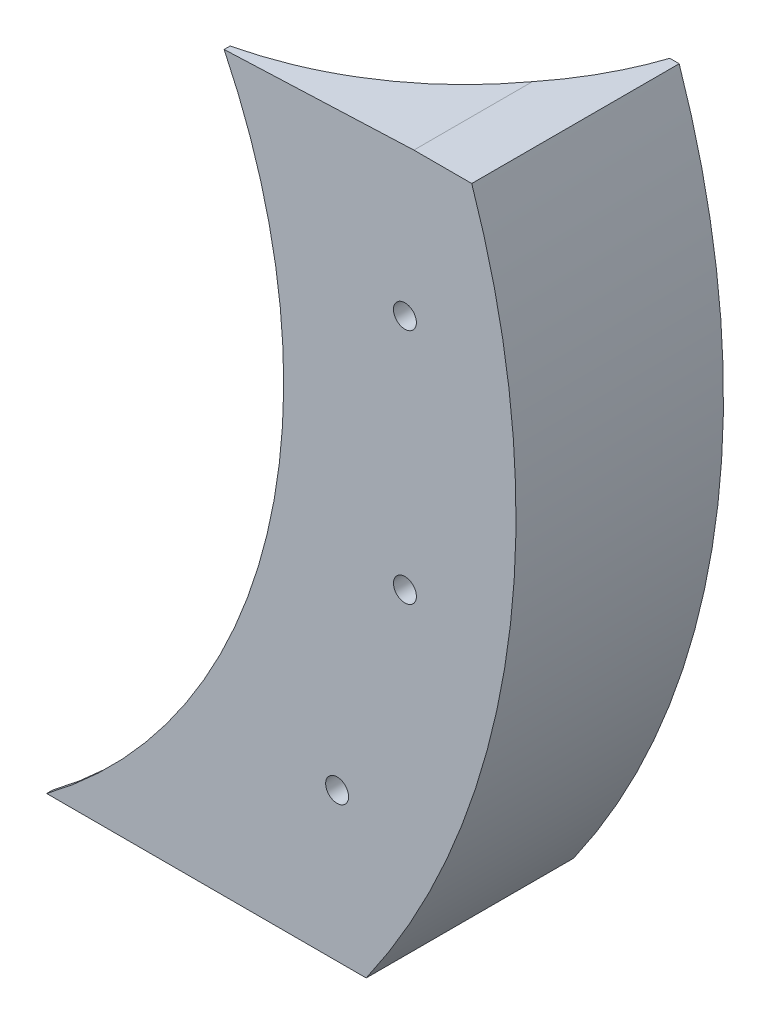
from build123d import *

# Parameters (mm, degrees)
BOSS_EXTRUDE1_DEPTH  = 44.45
CUT_SWEEP2_PROFILE_R = 63.5


# Read off the part's stored shape, not the designer's step: #10 (0.1935) Diameter Hole1
with BuildPart() as part:
    # Sketch1 → Boss-Extrude1 (new body)
    with BuildSketch(Plane.XY):
        with BuildLine():
            ThreePointArc((114.233948766, 55.494188428), (123.433861724, -29.884473893), (76.2, -101.6))
            Line((76.2, -101.6), (130.136274728, -101.6))
            ThreePointArc((130.136274728, -101.6), (163.128273679, -25.439660506), (154.893148654, 57.15))
            Line((154.893148654, 57.15), (114.233948766, 55.494188428))
        make_face()
        with BuildLine():
            ThreePointArc((154.893148654, 57.15), (163.128273679, -25.439660506), (130.136274728, -101.6))
            Line((130.136274728, -101.6), (144.672121212, -101.6))
            ThreePointArc((144.672121212, -101.6), (175.016349172, -24.937124506), (167.291542392, 57.15))
            Line((167.291542392, 57.15), (154.893148654, 57.15))
        make_face()
    extrude(amount=BOSS_EXTRUDE1_DEPTH)

    # Cut-Sweep2: sweep along a path in Sketch4
    with BuildLine(Plane(origin=(0, 0, -19.05), x_dir=(-1, 0, 0), z_dir=(0, 0, -1))) as cut_sweep2_path:
        ThreePointArc((-99.924396675, 55.494188428), (-109.396263278, -33.120198984), (-52.363441445, -101.6))
    # Cut-Sweep2 profile (on start of the path) → Cut-Sweep2 (sweep, cut)
    with BuildSketch(Plane(origin=(99.924396675, 55.494188428, -19.05), x_dir=(-0.874229192252917, -0.4855134595588597, 0), z_dir=(0.4855134595588597, -0.874229192252917, 0))):
        Circle(CUT_SWEEP2_PROFILE_R)
    sweep(path=cut_sweep2_path.line, mode=Mode.SUBTRACT)

    # #10 (0.1935) Diameter Hole1 outline → #10 (0.1935) Diameter Hole1 (revolve, cut)
    with BuildSketch(Plane(origin=(138.444039196, -69.85, 0), x_dir=(1, 0, 0), z_dir=(0, -1, 0))):
        Polygon((5.3975, 24.550727953), (5.3975, 29.635744444), (2.45745, 32.575794433), (2.45745, 44.45), (0, 44.45), (0, 24.550727953), align=None)
    revolve(axis=Axis((138.444039196, -69.85, 0), (0, 0, 1)), mode=Mode.SUBTRACT)

    # 10 _0.1935_ Diameter Hole1 2 outline → 10 _0.1935_ Diameter Hole1 2 (revolve, cut)
    with BuildSketch(Plane(origin=(152.972593915, -25.4, 0), x_dir=(1, 0, 0), z_dir=(0, -1, 0))):
        Polygon((5.3975, 24.550727953), (5.3975, 29.635744444), (2.45745, 32.575794433), (2.45745, 44.45), (0, 44.45), (0, 24.550727953), align=None)
    revolve(axis=Axis((152.972593915, -25.4, 0), (0, 0, 1)), mode=Mode.SUBTRACT)

    # 10 _0.1935_ Diameter Hole1 3 outline → 10 _0.1935_ Diameter Hole1 3 (revolve, cut)
    with BuildSketch(Plane(origin=(152.972593915, 25.4, 0), x_dir=(1, 0, 0), z_dir=(0, -1, 0))):
        Polygon((5.3975, 24.550727953), (5.3975, 29.635744444), (2.45745, 32.575794433), (2.45745, 44.45), (0, 44.45), (0, 24.550727953), align=None)
    revolve(axis=Axis((152.972593915, 25.4, 0), (0, 0, 1)), mode=Mode.SUBTRACT)


solid = part.part
